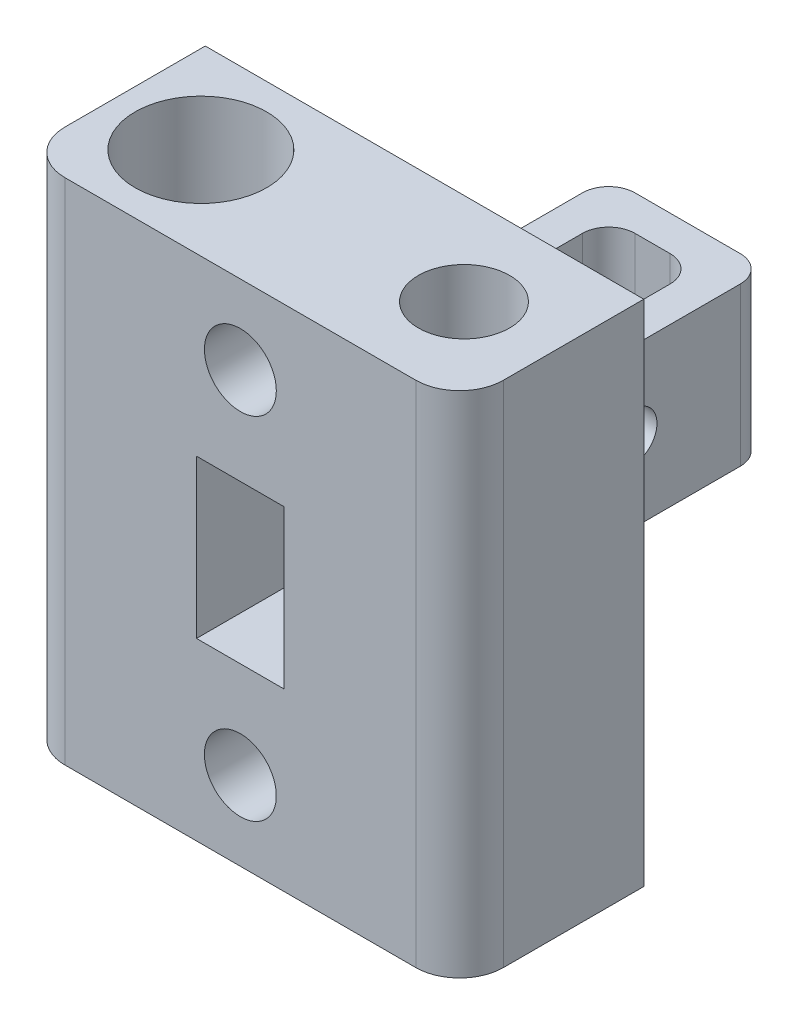
from build123d import *

# Parameters (mm, degrees)
SKETCH1_W           = 50
SKETCH1_H           = 21
BOSS_EXTRUDE1_DEPTH = 58
SKETCH3_R           = 7.5
CUT_EXTRUDE1_DEPTH  = 24
CUT_EXTRUDE2_REACH  = 66.025
SKETCH4_R           = 5.2
CUT_EXTRUDE3_START  = -24
SKETCH5_R           = 7.5
CUT_EXTRUDE3_DEPTH  = 24
CUT_EXTRUDE4_REACH  = 66.025
SKETCH6_R           = 4.5
CUT_EXTRUDE5_REACH  = 68.558
SKETCH8_W           = 10
SKETCH8_H           = 18
SKETCH7_R           = 4.1
CUT_EXTRUDE6_DEPTH  = 15
SKETCH11_W          = 4
SKETCH11_H          = 18
BOSS_EXTRUDE2_DEPTH = 26
SKETCH12_W          = 18
SKETCH12_H          = 18
BOSS_EXTRUDE3_DEPTH = 4
CUT_EXTRUDE7_DEPTH  = 79.487260113
FILLET1_R           = 5
FILLET2_R           = 5
FILLET3_R           = 3
SKETCH14_R          = 1.95
CUT_EXTRUDE8_DEPTH  = 10


with BuildPart() as part:
    # Sketch1 → Boss-Extrude1 (new body)
    with BuildSketch(Plane(origin=(0, 0, 0), x_dir=(1, 0, 0), z_dir=(0, 1, 0))):
        Rectangle(SKETCH1_W, SKETCH1_H)
    extrude(amount=BOSS_EXTRUDE1_DEPTH)

    # Sketch3 → Cut-Extrude1 (cut)
    with BuildSketch(Plane(origin=(0, 58, 0), x_dir=(1, 0, 0), z_dir=(0, 1, 0))):
        with Locations((-15, 0)):
            Circle(SKETCH3_R)
    extrude(amount=-CUT_EXTRUDE1_DEPTH, mode=Mode.SUBTRACT)

    # Sketch4 → Cut-Extrude2 (cut, up to next)
    with BuildSketch(Plane(origin=(0, 58, 0), x_dir=(1, 0, 0), z_dir=(0, 1, 0)), mode=Mode.PRIVATE) as cut_extrude2_sk1:
        with Locations((15, 0)):
            Circle(SKETCH4_R)
    cut_extrude2_tool1 = extrude(cut_extrude2_sk1.sketch, amount=-CUT_EXTRUDE2_REACH, mode=Mode.PRIVATE) & part.part
    add(cut_extrude2_tool1.solids().sort_by_distance((15, 58, 0))[0], mode=Mode.SUBTRACT)

    # Sketch5 → Cut-Extrude3 (cut)
    with BuildSketch(Plane.XZ.offset(CUT_EXTRUDE3_START)):
        with Locations((-15, 0)):
            Circle(SKETCH5_R)
    extrude(amount=CUT_EXTRUDE3_DEPTH, mode=Mode.SUBTRACT)

    # Sketch6 → Cut-Extrude4 (cut, up to next)
    with BuildSketch(Plane.XZ, mode=Mode.PRIVATE) as cut_extrude4_sk1:
        with Locations((-15, 0)):
            Circle(SKETCH6_R)
    cut_extrude4_tool1 = extrude(cut_extrude4_sk1.sketch, amount=-CUT_EXTRUDE4_REACH, mode=Mode.PRIVATE) & part.part
    add(cut_extrude4_tool1.solids().sort_by_distance((-15, 0, 0))[0], mode=Mode.SUBTRACT)

    # Sketch8 → Cut-Extrude5 (cut, up to next)
    with BuildSketch(Plane.XY.offset(10.5), mode=Mode.PRIVATE) as cut_extrude5_sk1:
        with Locations((0, 29)):
            Rectangle(SKETCH8_W, SKETCH8_H)
    cut_extrude5_tool1 = extrude(cut_extrude5_sk1.sketch, amount=-CUT_EXTRUDE5_REACH, mode=Mode.PRIVATE) & part.part
    add(cut_extrude5_tool1.solids().sort_by_distance((0, 29, 10.5))[0], mode=Mode.SUBTRACT)

    # Sketch7 → Cut-Extrude6 (cut)
    with BuildSketch(Plane.XY.offset(10.5)):
        with Locations((0, 49)):
            Circle(SKETCH7_R)
        with Locations((0, 9)):
            Circle(SKETCH7_R)
    extrude(amount=-CUT_EXTRUDE6_DEPTH, mode=Mode.SUBTRACT)

    # Sketch11 → Boss-Extrude2 (add)
    with BuildSketch(Plane(origin=(0, 0, -10.5), x_dir=(-1, 0, 0), z_dir=(0, 0, -1))):
        with Locations((7, 29)):
            Rectangle(SKETCH11_W, SKETCH11_H)
        with Locations((-7, 29)):
            Rectangle(SKETCH11_W, SKETCH11_H)
    extrude(amount=BOSS_EXTRUDE2_DEPTH)

    # Sketch12 → Boss-Extrude3 (add)
    with BuildSketch(Plane(origin=(0, 0, -36.5), x_dir=(-1, 0, 0), z_dir=(0, 0, -1))):
        with Locations((0, 29)):
            Rectangle(SKETCH12_W, SKETCH12_H)
    extrude(amount=BOSS_EXTRUDE3_DEPTH)

    # Sketch13 → Cut-Extrude7 (cut, through all)
    with BuildSketch(Plane(origin=(9, 0, 0), x_dir=(0, 0, -1), z_dir=(1, 0, 0))):
        with BuildLine():
            Line((16.25, 31.75), (25.25, 31.75))
            ThreePointArc((25.25, 31.75), (28, 29), (25.25, 26.25))
            Line((25.25, 26.25), (16.25, 26.25))
            ThreePointArc((16.25, 26.25), (13.5, 29), (16.25, 31.75))
        make_face()
    extrude(amount=-CUT_EXTRUDE7_DEPTH, mode=Mode.SUBTRACT)

    # Fillet1
    fillet1_edges = [part.edges().sort_by_distance(p)[0] for p in [
        (-25, 29, 10.5),
        (25, 29, 10.5),
    ]]
    fillet(fillet1_edges, radius=FILLET1_R)

    # Fillet2
    fillet2_edges = [part.edges().sort_by_distance(p)[0] for p in [
        (-7, 20, -10.5),
        (7, 20, -10.5),
        (-7, 38, -10.5),
        (7, 38, -10.5),
    ]]
    fillet(fillet2_edges, radius=FILLET2_R)

    # Fillet3
    fillet3_edges = [part.edges().sort_by_distance(p)[0] for p in [
        (-5, 29, -36.5),
        (5, 29, -36.5),
        (-9, 29, -40.5),
        (9, 29, -40.5),
    ]]
    fillet(fillet3_edges, radius=FILLET3_R)

    # Sketch14 → Cut-Extrude8 (cut)
    with BuildSketch(Plane.XZ):
        with Locations((20.550788232, 5.550788232)):
            Circle(SKETCH14_R)
        with Locations((9.449211768, -5.550788232)):
            Circle(SKETCH14_R)
    extrude(amount=-CUT_EXTRUDE8_DEPTH, mode=Mode.SUBTRACT)


solid = part.part
